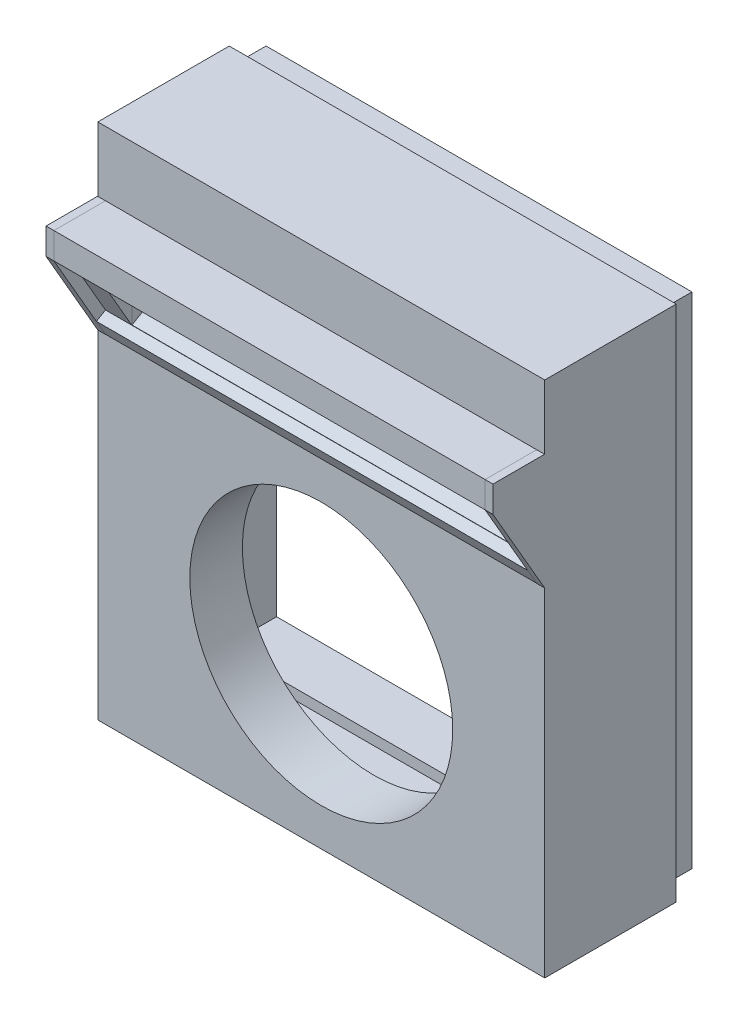
from build123d import *
from build123d.topology import SkipClean

# Parameters (mm, degrees)
SKETCH1_W                  = 2
SKETCH1_H                  = 2
BOSS_EXTRUDE1_DEPTH        = 10
BOSS_EXTRUDE3_DEPTH        = 20
BOSS_EXTRUDE3_DEPTH_BACK   = 5
SKETCH2_W                  = 85
SKETCH2_H                  = 98.49643328
SKETCH2_W_2                = 81
SKETCH2_H_2                = 95
SKETCH3_W                  = 81
SKETCH3_H                  = 95
BOSS_EXTRUDE4_DEPTH        = 2
BOSS_EXTRUDE6_DEPTH        = 41
BOSS_EXTRUDE6_DEPTH_BACK   = 41
BOSS_EXTRUDE6_2_DEPTH      = 41
BOSS_EXTRUDE6_2_DEPTH_BACK = 41
BOSS_EXTRUDE7_DEPTH        = 1.5
SKETCH15_W                 = 72
SKETCH15_H                 = 15
CUT_EXTRUDE2_DEPTH         = 15
CUT_EXTRUDE3_DEPTH         = 10
BOSS_EXTRUDE8_DEPTH        = 10


# Read off the part's stored shape, not the designer's step: Boss-Extrude7
with BuildPart() as part:
    # Sketch1 → Boss-Extrude1 (new body)
    with BuildSketch(Plane.XY):
        Polygon((-49.196743418, -18.776119502), (-47.196743418, -18.776119502), (-47.196743418, 72.223880498), (-24.196743418, 72.223880498), (-22.196743418, 72.223880498), (29.803256582, 72.223880498), (29.803256582, 74.223880498), (-49.196743418, 74.223880498), align=None)
        Polygon((-24.196743418, -18.776119502), (-47.196743418, -18.776119502), (-47.196743418, -20.776119502), (31.803256582, -20.776119502), (31.803256582, 72.223880498), (29.803256582, 72.223880498), (29.803256582, -18.776119502), (-22.196743418, -18.776119502), align=None)
        with Locations((-48.196743418, -19.776119502)):
            Rectangle(SKETCH1_W, SKETCH1_H)
        with Locations((30.803256582, 73.223880498)):
            Rectangle(SKETCH1_W, SKETCH1_H)
    extrude(amount=BOSS_EXTRUDE1_DEPTH)

    # Sketch2 → Boss-Extrude3 (add, two sides: drawn at the far end of the back side and taken through both)
    with BuildSketch(Plane.XY.offset(10).offset(-BOSS_EXTRUDE3_DEPTH_BACK)):
        with Locations((-8.696743418, 26.472097138)):
            Rectangle(SKETCH2_W, SKETCH2_H)
        with Locations((-8.696743418, 26.723880498)):
            Rectangle(SKETCH2_W_2, SKETCH2_H_2, mode=Mode.SUBTRACT)
    extrude(amount=BOSS_EXTRUDE3_DEPTH + BOSS_EXTRUDE3_DEPTH_BACK)

    # Sketch3 → Boss-Extrude4 (add)
    with BuildSketch(Plane.XY.offset(30)):
        with Locations((-8.696743418, 26.723880498)):
            Rectangle(SKETCH3_W, SKETCH3_H)
    extrude(amount=-BOSS_EXTRUDE4_DEPTH)

    # Boss-Extrude7 outline → Boss-Extrude7 (add)
    with BuildSketch(Plane(origin=(32.303256582, 0, 0), x_dir=(0, 0, -1), z_dir=(1, 0, 0))):
        Polygon((-39.842927076, 63.496736875), (-39.842927076, 58.496736875), (-39.765386314, 58.496736875), (-39.823541886, 58.46316074), (-30, 41.448287084), (-30, 45.448287084), (-30.033525999, 45.506355818), (-30.033525999, 63.496736875), align=None)
    boss_extrude7 = extrude(amount=BOSS_EXTRUDE7_DEPTH)

    # Mirror2: Boss-Extrude7 across plane
    add(boss_extrude7.mirror(Plane(origin=(-8.696743418, 0, 0), x_dir=(0, 0, 1), z_dir=(1, 0, 0))))


with BuildPart() as body_2:
    # Sketch9 → Boss-Extrude6 (new, two sides: drawn at the far end of the back side and taken through both)
    with BuildSketch(Plane(origin=(-8.696743418, 0, 0), x_dir=(0, 0, -1), z_dir=(1, 0, 0)).offset(-BOSS_EXTRUDE6_DEPTH_BACK)):
        Polygon((-30.033525999, 45.506355818), (-30.033525999, 63.496736875), (-39.842927076, 63.496736875), (-39.842927076, 58.496736875), (-37.533525999, 58.496736875), align=None)
    extrude(amount=BOSS_EXTRUDE6_DEPTH + BOSS_EXTRUDE6_DEPTH_BACK)


with BuildPart() as body_3:
    # Sketch9 → Boss-Extrude6 2 (new, two sides: drawn at the far end of the back side and taken through both)
    with BuildSketch(Plane(origin=(-8.696743418, 0, 0), x_dir=(0, 0, -1), z_dir=(1, 0, 0)).offset(-BOSS_EXTRUDE6_2_DEPTH_BACK)):
        Polygon((-30.033525999, 41.506355818), (-30.033525999, 45.506355818), (-31.765576807, 44.506355818), align=None)
    extrude(amount=BOSS_EXTRUDE6_2_DEPTH + BOSS_EXTRUDE6_2_DEPTH_BACK)


with BuildPart() as cut_extrude2_tool:
    # Sketch15 → Cut-Extrude2 (new body)
    with BuildSketch(Plane(origin=(0, -1.628309286, 2.820314413), x_dir=(1, 0, 0), z_dir=(0, -0.5000000000000001, 0.8660254037844386))):
        with Locations((-8.696743418, 61.926423172)):
            Rectangle(SKETCH15_W, SKETCH15_H)
    extrude(amount=-CUT_EXTRUDE2_DEPTH)


with BuildPart() as part_1:
    add(part.part)

    # Cut-Extrude2: cut by cut_extrude2_tool
    add(cut_extrude2_tool.part, mode=Mode.SUBTRACT)

    # Sketch16 → Cut-Extrude3 (cut)
    with BuildSketch(Plane.XY.offset(30)):
        with BuildLine():
            ThreePointArc((-8.696743418, 34.365118158), (-33.696743418, 9.365118158), (-8.696743418, -15.634881842))
            Line((-8.696743418, -15.634881842), (-8.696743418, 34.365118158))
        make_face()
        with BuildLine():
            Line((-8.696743418, 34.365118158), (-8.696743418, -15.634881842))
            ThreePointArc((-8.696743418, -15.634881842), (8.980926112, -8.312551372), (16.303256582, 9.365118158))
            ThreePointArc((16.303256582, 9.365118158), (8.980926112, 27.042787688), (-8.696743418, 34.365118158))
        make_face()
    extrude(amount=-CUT_EXTRUDE3_DEPTH, mode=Mode.SUBTRACT)

    # Sketch16<3> → Boss-Extrude8 (add)
    with SkipClean():  # the faces are left unmerged after this step: merging them gives an invalid solid
        with BuildSketch(Plane.XY.offset(30)):
            with BuildLine():
                ThreePointArc((-8.696743418, 37.365118158), (-36.696743418, 9.365118158), (-8.696743418, -18.634881842))
                Line((-8.696743418, -18.634881842), (-8.696743418, -15.634881842))
                ThreePointArc((-8.696743418, -15.634881842), (-33.696743418, 9.365118158), (-8.696743418, 34.365118158))
                Line((-8.696743418, 34.365118158), (-8.696743418, 37.365118158))
            make_face()
            with BuildLine():
                Line((-8.696743418, -15.634881842), (-8.696743418, -18.634881842))
                ThreePointArc((-8.696743418, -18.634881842), (11.102246456, -10.433871715), (19.303256582, 9.365118158))
                ThreePointArc((19.303256582, 9.365118158), (11.102246456, 29.164108031), (-8.696743418, 37.365118158))
                Line((-8.696743418, 37.365118158), (-8.696743418, 34.365118158))
                ThreePointArc((-8.696743418, 34.365118158), (8.980926112, 27.042787688), (16.303256582, 9.365118158))
                ThreePointArc((16.303256582, 9.365118158), (8.980926112, -8.312551372), (-8.696743418, -15.634881842))
            make_face()
        extrude(amount=-BOSS_EXTRUDE8_DEPTH)


with BuildPart() as body_2_1:
    add(body_2.part)

    # Cut-Extrude2: cut by cut_extrude2_tool
    add(cut_extrude2_tool.part, mode=Mode.SUBTRACT)


solid = Compound([body_3.part, part_1.part, body_2_1.part])
